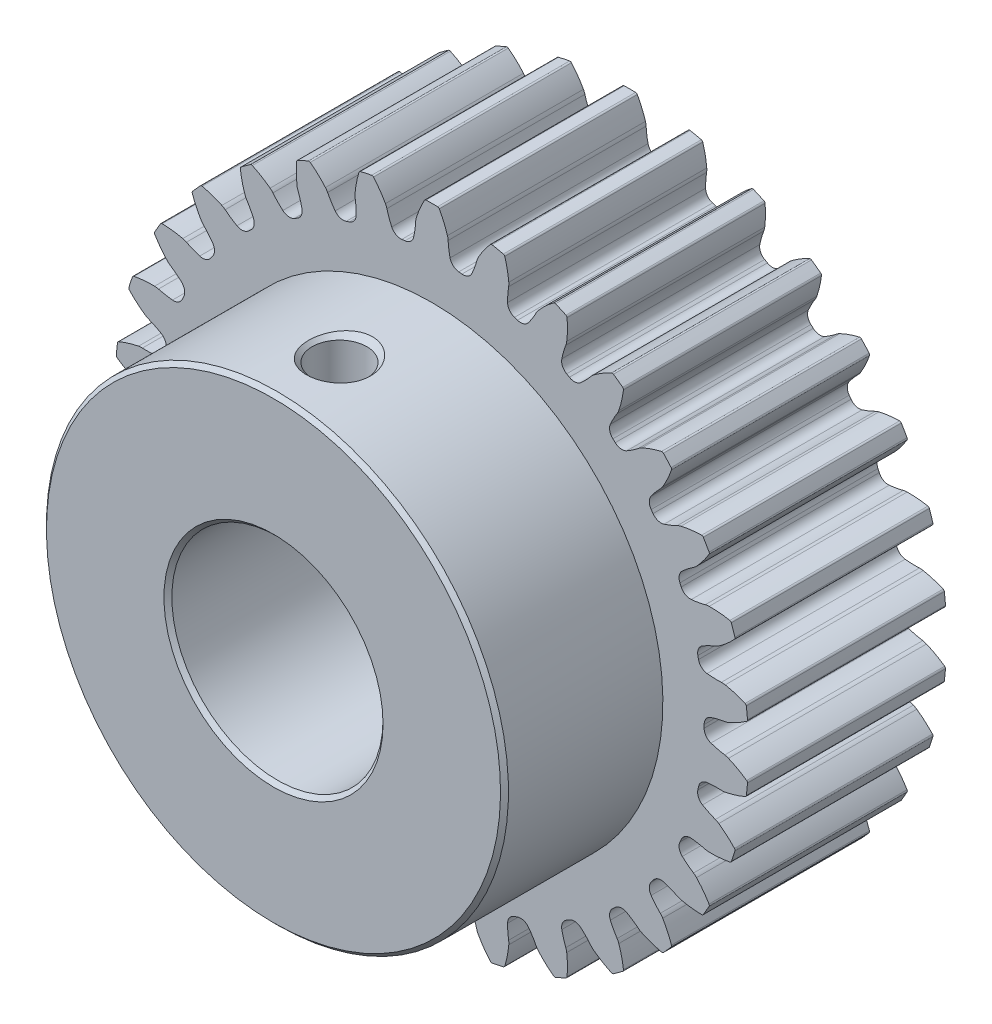
from build123d import *

# Parameters (mm, degrees)
BOSS_EXTRUDE1_DEPTH        = 14.999999999999986
SKETCH2_W                  = 17.5
SKETCH2_H                  = 12.000000000000059
F_16_0_16_DIAMETER_HOLE1_D = 16
FILLET1_R                  = 0.15000000000029293
CHAMFER4_SIZE              = 0.2999999999999612
FILLET2_R                  = 0.750000000002657
FILLET3_R                  = 1.23136375526401
CUT_EXTRUDE1_DEPTH         = 0.1


# Read off the part's stored shape, not the designer's step: CSK for M3.5 Flat Head Machine Screw1
with BuildPart() as part:
    # Sketch1 → Boss-Extrude1 (new body)
    with BuildSketch(Plane.XY.offset(14.999999999999963)):
        with BuildLine():
            ThreePointArc((1.2231787802915635, 22.313983465248278), (0.9222219034490218, 23.175656424877758), (0.5188259000153651, 23.99439142198561))
            ThreePointArc((0.5188259000153651, 23.99439142198561), (-1.696069e-11, 24.000000000541473), (-0.5188259000492833, 23.994391421984897))
            ThreePointArc((-0.5188259000492833, 23.994391421984897), (-0.9222219034977819, 23.175656424861856), (-1.223178780350769, 22.313983465214648))
            ThreePointArc((-1.223178780350769, 22.313983465214648), (-1.3138349595116834, 21.43149171299081), (-1.5208617788278387, 20.56885034391152))
            ThreePointArc((-1.5208617788278387, 20.56885034391152), (-2.155899554963689, 20.51201409246215), (-2.7888771532042846, 20.43557655767753))
            ThreePointArc((-2.7888771532042846, 20.43557655767753), (-3.170733165437452, 21.236323847095935), (-3.4428886419259737, 22.08068255772007))
            ThreePointArc((-3.4428886419259737, 22.08068255772007), (-3.9164207709020538, 22.86095344267094), (-4.481226181387061, 23.577926370584883))
            ThreePointArc((-4.481226181387061, 23.577926370584883), (-4.989880579751382, 23.475542418124537), (-5.496202800014235, 23.362186430347656))
            ThreePointArc((-5.496202800014235, 23.362186430347656), (-5.720559055347514, 22.47747201211657), (-5.835787420387989, 21.572056220878515))
            ThreePointArc((-5.835787420387989, 21.572056220878515), (-5.74098219218881, 20.69000055129112), (-5.764131753173712, 19.80316666979393))
            ThreePointArc((-5.764131753173712, 19.80316666979393), (-6.373475509143122, 19.61554064902886), (-6.976728771086535, 19.40917001506732))
            ThreePointArc((-6.976728771086535, 19.40917001506732), (-7.516725036131348, 20.113026725852343), (-7.958485309662301, 20.882349867522553))
            ThreePointArc((-7.958485309662301, 20.882349867522553), (-8.583897064477329, 21.547117095968833), (-9.285427175338672, 22.130992797323014))
            ThreePointArc((-9.285427175338672, 22.130992797323014), (-9.761679434030855, 21.925090983862418), (-10.233369263894188, 21.70894178747422))
            ThreePointArc((-10.233369263894188, 21.70894178747422), (-10.268880326169867, 20.796914213550714), (-10.193344146917623, 19.8873266054751))
            ThreePointArc((-10.193344146917623, 19.8873266054751), (-9.91722095475834, 19.0442570838499), (-9.755481510518136, 18.171989586049804))
            ThreePointArc((-9.755481510518136, 18.171989586049804), (-10.312500000219863, 17.861773953408015), (-10.859663863579335, 17.534489607252436))
            ThreePointArc((-10.859663863579335, 17.534489607252436), (-11.534199953467802, 18.110693823664615), (-12.12625798028838, 18.77135828347044))
            ThreePointArc((-12.12625798028838, 18.77135828347044), (-12.876215866197487, 19.291568337621637), (-13.683810445275084, 19.716828642519385))
            ThreePointArc((-13.683810445275084, 19.716828642519385), (-14.106846055277872, 19.416407865334193), (-14.523288385757233, 19.106912217416653))
            ThreePointArc((-14.523288385757233, 19.106912217416653), (-14.368402251151066, 18.20743146917753), (-14.105402821100187, 17.333425387425823))
            ThreePointArc((-14.105402821100187, 17.333425387425823), (-13.66002957346505, 16.56618819735303), (-13.320469913827816, 15.74660935850535))
            ThreePointArc((-13.320469913827816, 15.74660935850535), (-13.800818756387203, 15.32736202571702), (-14.267979534747194, 14.893467863783062))
            ThreePointArc((-14.267979534747194, 14.893467863783062), (-15.047574985570186, 15.316836696631597), (-15.764054988899192, 15.839968267463554))
            ThreePointArc((-15.764054988899192, 15.839968267463554), (-16.605782247590824, 16.19288547170547), (-17.484145536508535, 16.44094446419741))
            ThreePointArc((-17.484145536508535, 16.44094446419741), (-17.835475811713412, 16.059134552831537), (-18.178470114653614, 15.66981889832569))
            ThreePointArc((-18.178470114653614, 15.66981889832569), (-17.8399560504744, 14.822196600661677), (-17.400987706731737, 14.021970304957653))
            ThreePointArc((-17.400987706731737, 14.021970304957653), (-16.805829351680593, 13.364097393253639), (-16.30328986315027, 12.63302674139516))
            ThreePointArc((-16.30328986315027, 12.63302674139516), (-16.68597550918335, 12.123070828672295), (-17.052716034848526, 11.601530107888593))
            ThreePointArc((-17.052716034848526, 11.601530107888593), (-17.90329878448461, 11.853560307632172), (-18.712887150120416, 12.216295629579742))
            ThreePointArc((-18.712887150120416, 12.216295629579742), (-19.609596261337074, 12.386495808606238), (-20.52033956951892, 12.44651212040234))
            ThreePointArc((-20.52033956951892, 12.44651212040234), (-20.784609691029953, 12.00000000011154), (-21.039165469523518, 11.547879301264889))
            ThreePointArc((-21.039165469523518, 11.547879301264889), (-20.53181816475962, 10.789160615933142), (-19.93606593036406, 10.097687835315263))
            ThreePointArc((-19.93606593036406, 10.097687835315263), (-19.21713374388583, 9.577931405037365), (-18.573577813564857, 8.967320235701024))
            ThreePointArc((-18.573577813564857, 8.967320235701024), (-18.84187506400098, 8.388943263488152), (-19.092167016175093, 7.80254981600209))
            ThreePointArc((-19.092167016175093, 7.80254981600209), (-19.976562516924844, 7.872226453534833), (-20.8438763484614, 8.05871225243022))
            ThreePointArc((-20.8438763484614, 8.05871225243022), (-21.75637682115064, 8.03875684170439), (-22.65969629579279, 7.908107471987025))
            ThreePointArc((-22.65969629579279, 7.908107471987025), (-22.825356391192418, 7.416407865031748), (-22.98034833622626, 6.92124196590054))
            ThreePointArc((-22.98034833622626, 6.92124196590054), (-22.326341302602113, 6.284586540178793), (-21.599842408916416, 5.732087953208426))
            ThreePointArc((-21.599842408916416, 5.732087953208426), (-20.78855717739548, 5.373163854443546), (-20.03211128756907, 4.909698805790582))
            ThreePointArc((-20.03211128756907, 4.909698805790582), (-20.174294265143267, 4.288178623118547), (-20.297198684493395, 3.662560656397044))
            ThreePointArc((-20.297198684493395, 3.662560656397044), (-21.176754609169894, 3.546838528320049), (-22.063888130330156, 3.548924479900548))
            ThreePointArc((-22.063888130330156, 3.548924479900548), (-22.952299315174958, 3.3396856266285333), (-23.808715560630397, 3.024080579780507))
            ThreePointArc((-23.808715560630397, 3.024080579780507), (-23.86852548882544, 2.508683118423115), (-23.917179708668908, 1.9921131448708729))
            ThreePointArc((-23.917179708668908, 1.9921131448708729), (-23.14509619183324, 1.505345875877211), (-22.319602126644494, 1.1159683219901972))
            ThreePointArc((-22.319602126644494, 1.1159683219901972), (-21.45142090767448, 0.9335632601594162), (-20.61514537355768, 0.6374999787626534))
            ThreePointArc((-20.61514537355768, 0.6374999787626534), (-20.624999999879975, 3.15152e-12), (-20.61514537351956, -0.6374999787557728))
            ThreePointArc((-20.61514537351956, -0.6374999787557728), (-21.451420907635924, -0.9335632601520851), (-22.31960212660537, -1.1159683219828498))
            ThreePointArc((-22.31960212660537, -1.1159683219828498), (-23.145096191761642, -1.5053458758699065), (-23.917179708566838, -1.9921131448568512))
            ThreePointArc((-23.917179708566838, -1.9921131448568512), (-23.86852548869718, -2.5086831184040803), (-23.808715560476102, -3.0240805797559016))
            ThreePointArc((-23.808715560476102, -3.0240805797559016), (-22.952299314990455, -3.3396856265970065), (-22.063888130115814, -3.548924479855548))
            ThreePointArc((-22.063888130115814, -3.548924479855548), (-21.17675460895496, -3.5468385282750825), (-20.297198684277856, -3.6625606563520745))
            ThreePointArc((-20.297198684277856, -3.6625606563520745), (-20.17429426489256, -4.288178623058566), (-20.032111287283925, -4.909698805714563))
            ThreePointArc((-20.032111287283925, -4.909698805714563), (-20.78855717710985, -5.373163854367398), (-21.59984240863037, -5.732087953132043))
            ThreePointArc((-21.59984240863037, -5.732087953132043), (-22.326341302286647, -6.284586540089166), (-22.980348335885797, -6.921241965791525))
            ThreePointArc((-22.980348335885797, -6.921241965791525), (-22.825356390830063, -7.4164078649075265), (-22.659696295409034, -7.908107471847194))
            ThreePointArc((-22.659696295409034, -7.908107471847194), (-21.756376820767308, -8.038756841564494), (-20.8438763480785, -8.05871225229049))
            ThreePointArc((-20.8438763480785, -8.05871225229049), (-19.976562516519447, -7.8722264533696515), (-19.092167015743748, -7.802549815818106))
            ThreePointArc((-19.092167015743748, -7.802549815818106), (-18.841875063542634, -8.38894326327815), (-18.57357781308071, -8.967320235464362))
            ThreePointArc((-18.57357781308071, -8.967320235464362), (-19.21713374340199, -9.577931404798566), (-19.936065929879398, -10.097687835075469))
            ThreePointArc((-19.936065929879398, -10.097687835075469), (-20.531818164253963, -10.789160615669745), (-21.039165469003308, -11.547879300973221))
            ThreePointArc((-21.039165469003308, -11.547879300973221), (-20.784609690495977, -11.999999999796966), (-20.520339568971924, -12.446512120064723))
            ThreePointArc((-20.520339568971924, -12.446512120064723), (-19.609596260790923, -12.386495808268677), (-18.712887149575007, -12.216295629242811))
            ThreePointArc((-18.712887149575007, -12.216295629242811), (-17.903298783927518, -11.853560307263134), (-17.052716034274557, -11.601530107492808))
            ThreePointArc((-17.052716034274557, -11.601530107492808), (-16.68597550859746, -12.123070828239264), (-16.303289862554198, -12.633026740924961))
            ThreePointArc((-16.303289862554198, -12.633026740924961), (-16.805829351082203, -13.364097392784306), (-17.400987706133478, -14.021970304487391))
            ThreePointArc((-17.400987706133478, -14.021970304487391), (-17.839956049866885, -14.822196600161618), (-18.17847011404388, -15.669818897793602))
            ThreePointArc((-18.17847011404388, -15.669818897793602), (-17.83547581110054, -16.059134552272756), (-17.484145535893383, -16.440944463612155))
            ThreePointArc((-17.484145535893383, -16.440944463612155), (-16.60578224697319, -16.19288547111951), (-15.764054988279701, -15.839968266875376))
            ThreePointArc((-15.764054988279701, -15.839968266875376), (-15.047574984954789, -15.316836696012146), (-14.26797953413033, -14.893467863134582))
            ThreePointArc((-14.26797953413033, -14.893467863134582), (-13.800818755772095, -15.327362025031428), (-13.320469913216149, -15.746609357783337))
            ThreePointArc((-13.320469913216149, -15.746609357783337), (-13.660029572858292, -16.566188196629483), (-14.105402820492882, -17.333425386703126))
            ThreePointArc((-14.105402820492882, -17.333425386703126), (-14.368402250546414, -18.207431468422413), (-14.523288385162795, -19.106912216629055))
            ThreePointArc((-14.523288385162795, -19.106912216629055), (-14.106846054691305, -19.416407864520913), (-13.683810444697228, -19.71682864168098))
            ThreePointArc((-13.683810444697228, -19.71682864168098), (-12.876215865620614, -19.291568336783776), (-12.126257979712067, -18.771358282633738))
            ThreePointArc((-12.126257979712067, -18.771358282633738), (-11.534199952906238, -18.110693822797714), (-10.859663863027334, -17.53448960635487))
            ThreePointArc((-10.859663863027334, -17.53448960635487), (-10.312499999685754, -17.86177395247695), (-9.755481510003428, -18.17198958508668))
            ThreePointArc((-9.755481510003428, -18.17198958508668), (-9.917220954244584, -19.04425708288714), (-10.193344146404042, -19.887326604512833))
            ThreePointArc((-10.193344146404042, -19.887326604512833), (-10.268880325671923, -20.796914212560846), (-10.233369263418545, -21.708941786458997))
            ThreePointArc((-10.233369263418545, -21.708941786458997), (-9.761679433572567, -21.92509098282703), (-9.285427174898382, -22.130992796268306))
            ThreePointArc((-9.285427174898382, -22.130992796268306), (-8.583897064036986, -21.54711709491399), (-7.95848530922207, -20.882349866467425))
            ThreePointArc((-7.95848530922207, -20.882349866467425), (-7.516725035712751, -20.113026724778077), (-6.9767287706859955, -19.409170013971863))
            ThreePointArc((-6.9767287706859955, -19.409170013971863), (-6.3734755087807065, -19.615540647907174), (-5.764131752850617, -19.80316666864853))
            ThreePointArc((-5.764131752850617, -19.80316666864853), (-5.740982191863119, -20.690000550156576), (-5.835787420062725, -21.572056219754906))
            ThreePointArc((-5.835787420062725, -21.572056219754906), (-5.72055905504415, -22.47747201096548), (-5.496202799739497, -23.36218642917285))
            ThreePointArc((-5.496202799739497, -23.36218642917285), (-4.989880579500916, -23.47554241693834), (-4.48122618116122, -23.57792636938837))
            ThreePointArc((-4.48122618116122, -23.57792636938837), (-3.9164207706752387, -22.86095344147321), (-3.4428886416989966, -22.08068255652062))
            ThreePointArc((-3.4428886416989966, -22.08068255652062), (-3.1707331652418738, -21.23632384588983), (-2.7888771530389396, -20.43557655646066))
            ThreePointArc((-2.7888771530389396, -20.43557655646066), (-2.1558995548354685, -20.51201409123619), (-1.5208617787371066, -20.568850342678786))
            ThreePointArc((-1.5208617787371066, -20.568850342678786), (-1.31383495942075, -21.431491711757992), (-1.2231787802599614, -22.313983463981806))
            ThreePointArc((-1.2231787802599614, -22.313983463981806), (-0.9222219034379213, -23.17565642362364), (-0.5188259000226928, -23.994391420746034))
            ThreePointArc((-0.5188259000226928, -23.994391420746034), (-1.691806e-11, -23.99999999930204), (0.5188258999888663, -23.994391420746748))
            ThreePointArc((0.5188258999888663, -23.994391420746748), (0.9222219034225132, -23.175656423638827), (1.2231787802649363, -22.313983464009244))
            ThreePointArc((1.2231787802649363, -22.313983464009244), (1.3138349594054564, -21.43149171177405), (1.5208617787043899, -20.568850342681152))
            ThreePointArc((1.5208617787043899, -20.568850342681152), (2.1558995548032636, -20.512014091239493), (2.7888771530072796, -20.435576556464873))
            ThreePointArc((2.7888771530072796, -20.435576556464873), (3.17073316522213, -21.236323845874566), (3.4428886416975404, -22.080682556486376))
            ThreePointArc((3.4428886416975404, -22.080682556486376), (3.916420770656626, -22.860953441458165), (4.481226181127741, -23.577926369394593))
            ThreePointArc((4.481226181127741, -23.577926369394593), (4.989880579468132, -23.47554241694515), (5.496202799707409, -23.362186429180223))
            ThreePointArc((5.496202799707409, -23.362186429180223), (5.720559055031852, -22.477472010979184), (5.83578742007099, -21.572056219772506))
            ThreePointArc((5.83578742007099, -21.572056219772506), (5.740982191851119, -20.69000055017114), (5.764131752819407, -19.8031666686574))
            ThreePointArc((5.764131752819407, -19.8031666686574), (6.373475508750502, -19.615540647916742), (6.97672877065681, -19.409170013982088))
            ThreePointArc((6.97672877065681, -19.409170013982088), (7.516725035689554, -20.113026724763348), (7.958485309210426, -20.882349866427425))
            ThreePointArc((7.958485309210426, -20.882349866427425), (8.583897064015003, -21.547117094899708), (9.285427174870023, -22.130992796279898))
            ThreePointArc((9.285427174870023, -22.130992796279898), (9.761679433544888, -21.925090982839023), (10.233369263391554, -21.708941786471378))
            ThreePointArc((10.233369263391554, -21.708941786471378), (10.268880325667325, -20.79691421258311), (10.193344146423735, -19.887326604542107))
            ThreePointArc((10.193344146423735, -19.887326604542107), (9.917220954239848, -19.044257082910253), (9.755481509977972, -18.17198958509995))
            ThreePointArc((9.755481509977972, -18.17198958509995), (10.312499999660215, -17.861773952491262), (10.859663863001753, -17.534489606370254))
            ThreePointArc((10.859663863001753, -17.534489606370254), (11.534199952873347, -18.11069382277715), (12.12625797967875, -18.771358282574738))
            ThreePointArc((12.12625797967875, -18.771358282574738), (12.876215865589892, -19.291568336763078), (13.683810444674744, -19.71682864169608))
            ThreePointArc((13.683810444674744, -19.71682864169608), (14.106846054669441, -19.416407864536264), (14.52328838514155, -19.10691221664465))
            ThreePointArc((14.52328838514155, -19.10691221664465), (14.368402250546549, -18.20743146844254), (14.105402820516288, -17.333425386724702))
            ThreePointArc((14.105402820516288, -17.333425386724702), (13.6600295728581, -16.566188196650394), (13.320469913197563, -15.746609357798432))
            ThreePointArc((13.320469913197563, -15.746609357798432), (13.800818755754266, -15.327362025046819), (14.267979534113248, -14.893467863150237))
            ThreePointArc((14.267979534113248, -14.893467863150237), (15.04757498491907, -15.3168366959964), (15.764054988232644, -15.83996826682198))
            ThreePointArc((15.764054988232644, -15.83996826682198), (16.605782246938976, -16.192885471103274), (17.48414553587716, -16.44094446362863))
            ThreePointArc((17.48414553587716, -16.44094446362863), (17.83547581108495, -16.059134552289258), (18.17847011402893, -15.669818897810092))
            ThreePointArc((18.17847011402893, -15.669818897810092), (17.839956049872043, -14.822196600178657), (17.400987706158876, -14.021970304502414))
            ThreePointArc((17.400987706158876, -14.021970304502414), (16.80582935108867, -13.364097392801554), (16.303289862538893, -12.633026740943766))
            ThreePointArc((16.303289862538893, -12.633026740943766), (16.685975508585194, -12.123070828255127), (17.052716034265146, -11.60153010750557))
            ThreePointArc((17.052716034265146, -11.60153010750557), (17.90329878389009, -11.853560307253307), (18.712887149516607, -12.216295629198383))
            ThreePointArc((18.712887149516607, -12.216295629198383), (19.60959626075501, -12.386495808256422), (20.5203395689624, -12.4465121200792))
            ThreePointArc((20.5203395689624, -12.4465121200792), (20.784609690487205, -11.999999999810873), (21.03916546899526, -11.547879300986537))
            ThreePointArc((21.03916546899526, -11.547879300986537), (20.531818164249877, -10.789160615673858), (19.93606592987788, -10.097687835070179))
            ThreePointArc((19.93606592987788, -10.097687835070179), (19.21713374339856, -9.577931404802056), (18.573577813074216, -8.967320235476299))
            ThreePointArc((18.573577813074216, -8.967320235476299), (18.8418750635366, -8.38894326329007), (19.09216701573816, -7.802549815829989))
            ThreePointArc((19.09216701573816, -7.802549815829989), (19.976562516490258, -7.872226453367115), (20.84387634802858, -8.058712252267073))
            ThreePointArc((20.84387634802858, -8.058712252267073), (21.75637682073939, -8.038756841560334), (22.659696295404924, -7.908107471856872))
            ThreePointArc((22.659696295404924, -7.908107471856872), (22.82535639082618, -7.416407864917207), (22.980348335882145, -6.921241965801194))
            ThreePointArc((22.980348335882145, -6.921241965801194), (22.32634130228788, -6.284586540092574), (21.59984240863564, -5.73208795312871))
            ThreePointArc((21.59984240863564, -5.73208795312871), (20.788557177111453, -5.373163854369299), (20.03211128728182, -4.909698805720144))
            ThreePointArc((20.03211128728182, -4.909698805720144), (20.17429426489052, -4.288178623064702), (20.297198684275916, -3.6625606563587687))
            ThreePointArc((20.297198684275916, -3.6625606563587687), (21.176754608983988, -3.546838528286451), (22.06388813017491, -3.548924479879939))
            ThreePointArc((22.06388813017491, -3.548924479879939), (22.95229931501955, -3.339685626607999), (23.808715560474838, -3.0240805797600823))
            ThreePointArc((23.808715560474838, -3.0240805797600823), (23.868525488696093, -2.508683118407406), (23.917179708565893, -1.9921131448593143))
            ThreePointArc((23.917179708565893, -1.9921131448593143), (23.14509619176534, -1.5053458758694012), (22.319602126613503, -1.1159683219784584))
            ThreePointArc((22.319602126613503, -1.1159683219784584), (21.451420907639697, -0.933563260150855), (20.6151453735188, -0.6374999787565113))
            ThreePointArc((20.6151453735188, -0.6374999787565113), (20.62499999987923, 3.6675e-12), (20.615145373556885, 0.6374999787644352))
            ThreePointArc((20.615145373556885, 0.6374999787644352), (21.451420907708304, 0.9335632601657586), (22.31960212671403, 1.115968321992694))
            ThreePointArc((22.31960212671403, 1.115968321992694), (23.145096191866717, 1.5053458758836173), (23.91717970866792, 1.9921131448739104))
            ThreePointArc((23.91717970866792, 1.9921131448739104), (23.868525488824282, 2.5086831184272023), (23.808715560629025, 3.024080579785638))
            ThreePointArc((23.808715560629025, 3.024080579785638), (22.952299315174148, 3.339685626633328), (22.063888130330053, 3.548924479905543))
            ThreePointArc((22.063888130330053, 3.548924479905543), (21.1767546091689, 3.5468385283252077), (20.297198684491597, 3.6625606564029205))
            ThreePointArc((20.297198684491597, 3.6625606564029205), (20.174294265141093, 4.288178623125283), (20.032111287566476, 4.909698805798158))
            ThreePointArc((20.032111287566476, 4.909698805798158), (20.78855717742217, 5.3731638544658145), (21.599842408975952, 5.732087953237158))
            ThreePointArc((21.599842408975952, 5.732087953237158), (22.32634130262843, 6.2845865402008325), (22.98034833622286, 6.921241965909382))
            ThreePointArc((22.98034833622286, 6.921241965909382), (22.825356391188585, 7.416407865041283), (22.659696295788493, 7.908107471997242))
            ThreePointArc((22.659696295788493, 7.908107471997242), (21.756376821146574, 8.03875684171852), (20.84387634845709, 8.058712252448343))
            ThreePointArc((20.84387634845709, 8.058712252448343), (19.976562516920687, 7.872226453548568), (19.092167016170496, 7.802549816011527))
            ThreePointArc((19.092167016170496, 7.802549816011527), (18.84187506399458, 8.388943263500861), (18.573577813556447, 8.967320235716908))
            ThreePointArc((18.573577813556447, 8.967320235716908), (19.21713374389535, 9.577931405069815), (19.93606593039542, 10.097687835359165))
            ThreePointArc((19.93606593039542, 10.097687835359165), (20.531818164769085, 10.78916061596383), (21.03916546951561, 11.547879301277954))
            ThreePointArc((21.03916546951561, 11.547879301277954), (20.784609691021128, 12.000000000125535), (20.520339569509144, 12.44651212041724))
            ThreePointArc((20.520339569509144, 12.44651212041724), (19.609596261320835, 12.386495808624936), (18.71288715009737, 12.216295629601083))
            ThreePointArc((18.71288715009737, 12.216295629601083), (17.903298784465495, 11.853560307653556), (17.052716034833118, 11.601530107910161))
            ThreePointArc((17.052716034833118, 11.601530107910161), (16.68597550917143, 12.123070828687688), (16.303289863142208, 12.633026741404608))
            ThreePointArc((16.303289863142208, 12.633026741404608), (16.805829351689724, 13.364097393300764), (17.400987706769357, 14.021970305034008))
            ThreePointArc((17.400987706769357, 14.021970305034008), (17.839956050482403, 14.822196600710122), (18.178470114639392, 15.669818898341333))
            ThreePointArc((18.178470114639392, 15.669818898341333), (17.835475811698423, 16.059134552847357), (17.484145536492772, 16.440944464213388))
            ThreePointArc((17.484145536492772, 16.440944464213388), (16.605782247556682, 16.192885471719357), (15.764054988848155, 15.839968267470535))
            ThreePointArc((15.764054988848155, 15.839968267470535), (15.047574985535123, 15.316836696645371), (14.267979534730578, 14.89346786379828))
            ThreePointArc((14.267979534730578, 14.89346786379828), (13.800818756368148, 15.327362025733523), (13.320469913806214, 15.746609358523004))
            ThreePointArc((13.320469913806214, 15.746609358523004), (13.660029573454718, 16.566188197405054), (14.105402821108097, 17.333425387508964))
            ThreePointArc((14.105402821108097, 17.333425387508964), (14.368402251139912, 18.207431469228574), (14.52328838573525, 19.106912217432804))
            ThreePointArc((14.52328838573525, 19.106912217432804), (14.106846055255398, 19.416407865349978), (13.683810445252137, 19.7168286425348))
            ThreePointArc((13.683810445252137, 19.7168286425348), (12.876215866155622, 19.291568337631155), (12.126257980229468, 18.77135828347034))
            ThreePointArc((12.126257980229468, 18.77135828347034), (11.534199953424842, 18.110693823673877), (10.859663863554946, 17.534489607267083))
            ThreePointArc((10.859663863554946, 17.534489607267083), (10.312500000194369, 17.86177395342231), (9.755481510491533, 18.17198958606369))
            ThreePointArc((9.755481510491533, 18.17198958606369), (9.917220954731228, 19.04425708389686), (10.193344146897873, 19.88732660555376))
            ThreePointArc((10.193344146897873, 19.88732660555376), (10.268880326142684, 20.79691421359659), (10.233369263866821, 21.70894178748678))
            ThreePointArc((10.233369263866821, 21.70894178748678), (9.761679434002478, 21.925090983874735), (9.285427175309282, 22.130992797335036))
            ThreePointArc((9.285427175309282, 22.130992797335036), (8.583897064432719, 21.547117095978265), (7.958485309603566, 20.882349867526933))
            ThreePointArc((7.958485309603566, 20.882349867526933), (7.516725036082496, 20.11302672586206), (6.976728771048604, 19.409170015080694))
            ThreePointArc((6.976728771048604, 19.409170015080694), (6.373475509112457, 19.61554064903858), (5.764131753150484, 19.803166669800472))
            ThreePointArc((5.764131753150484, 19.803166669800472), (5.740982192152049, 20.690000551328183), (5.835787420345929, 21.57205622094719))
            ThreePointArc((5.835787420345929, 21.57205622094719), (5.720559055306663, 22.477472012153928), (5.49620279998216, 23.36218643035503))
            ThreePointArc((5.49620279998216, 23.36218643035503), (4.9898805797192765, 23.475542418131212), (4.481226181354936, 23.577926370590852))
            ThreePointArc((4.481226181354936, 23.577926370590852), (3.9164207708520165, 22.860953442665647), (3.4428886418618747, 22.080682557699998))
            ThreePointArc((3.4428886418618747, 22.080682557699998), (3.1707331653871815, 21.236323847089544), (2.788877153171553, 20.435576557681898))
            ThreePointArc((2.788877153171553, 20.435576557681898), (2.1558995549306292, 20.512014092465552), (1.5208617787944851, 20.568850343913933))
            ThreePointArc((1.5208617787944851, 20.568850343913933), (1.3138349594631196, 21.431491713007755), (1.2231787802915635, 22.313983465248278))
        make_face()
    extrude(amount=-BOSS_EXTRUDE1_DEPTH)

    # Sketch2 → Revolve1 (revolve)
    with BuildSketch(Plane.XZ, mode=Mode.PRIVATE) as revolve1_sk:
        with Locations((8.75, 20.999999999999993)):
            Rectangle(SKETCH2_W, SKETCH2_H)
    revolve(revolve1_sk.sketch.rotate(Axis((0, -5.684e-14, 27.000000000000025), (0, 2.11e-15, -1)), 270), axis=Axis((0, -5.684e-14, 27.000000000000025), (0, 2.11e-15, -1)))

    # Ø16.0 (16) Diameter Hole1 (through all)
    with Locations(Plane.XY.offset(27.000000000000025)):
        with Locations((0, 0)):
            Hole(F_16_0_16_DIAMETER_HOLE1_D / 2)

    # CSK for M3.5 Flat Head Machine Screw1 ou → CSK for M3.5 Flat Head Machine Screw1 (revolve, cut)
    with BuildSketch(Plane.XY.offset(22)):
        Polygon((0, 7.728317894), (2.067, 7.728317894), (2.067, 17.067), (2.49998048, 17.49998048), (0, 17.49998048), align=None)
    revolve(axis=Axis((0, 0, 22), (0, 1, 0)), mode=Mode.SUBTRACT)

    # Fillet1
    fillet1_edges = [part.edges().sort_by_distance(p)[0] for p in [
        (4.481226181354936, 23.577926370590852, 7.49999999999997),
        (5.496202799982161, 23.362186430355035, 7.49999999999997),
        (9.285427175309284, 22.130992797335036, 7.49999999999997),
        (10.23336926386682, 21.70894178748678, 7.49999999999997),
        (13.683810445252137, 19.7168286425348, 7.49999999999997),
        (14.523288385735253, 19.106912217432804, 7.49999999999997),
        (17.48414553649277, 16.440944464213388, 7.49999999999997),
        (18.17847011463939, 15.669818898341333, 7.49999999999997),
        (20.520339569509144, 12.446512120417239, 7.49999999999997),
        (21.03916546951561, 11.547879301277952, 7.49999999999997),
        (22.659696295788493, 7.9081074719972415, 7.49999999999997),
        (22.98034833622286, 6.921241965909383, 7.49999999999997),
        (23.80871556062903, 3.024080579785638, 7.49999999999997),
        (23.917179708667923, 1.9921131448739104, 7.49999999999997),
        (23.917179708565897, -1.9921131448593146, 7.49999999999997),
        (23.808715560474838, -3.0240805797600827, 7.49999999999997),
        (22.980348335882148, -6.921241965801194, 7.49999999999997),
        (22.659696295404927, -7.908107471856873, 7.49999999999997),
        (21.039165468995257, -11.547879300986535, 7.49999999999997),
        (20.5203395689624, -12.4465121200792, 7.49999999999997),
        (18.178470114028926, -15.66981889781009, 7.49999999999997),
        (17.48414553587716, -16.44094446362863, 7.49999999999997),
        (14.52328838514155, -19.106912216644645, 7.49999999999997),
        (13.683810444674744, -19.716828641696075, 7.49999999999997),
        (10.233369263391555, -21.708941786471378, 7.49999999999997),
        (9.285427174870023, -22.130992796279898, 7.49999999999997),
        (5.49620279970741, -23.362186429180227, 7.49999999999997),
        (4.481226181127741, -23.577926369394596, 7.49999999999997),
        (0.5188258999888664, -23.994391420746744, 7.49999999999997),
        (-0.5188259000226935, -23.994391420746034, 7.49999999999997),
        (-4.481226181161219, -23.577926369388372, 7.49999999999997),
        (-5.496202799739498, -23.36218642917285, 7.49999999999997),
        (-9.28542717489838, -22.13099279626831, 7.49999999999997),
        (-10.233369263418545, -21.708941786459, 7.49999999999997),
        (-13.68381044469723, -19.716828641680983, 7.49999999999997),
        (-14.523288385162797, -19.10691221662906, 7.49999999999997),
        (-17.484145535893383, -16.440944463612155, 7.49999999999997),
        (-18.178470114043876, -15.669818897793602, 7.49999999999997),
        (-20.520339568971927, -12.446512120064725, 7.49999999999997),
        (-21.039165469003308, -11.547879300973223, 7.49999999999997),
        (-22.659696295409034, -7.908107471847195, 7.49999999999997),
        (-22.980348335885797, -6.921241965791525, 7.49999999999997),
        (-23.808715560476102, -3.0240805797559016, 7.49999999999997),
        (-23.917179708566835, -1.9921131448568514, 7.49999999999997),
        (-23.91717970866891, 1.9921131448708733, 7.49999999999997),
        (-23.8087155606304, 3.0240805797805073, 7.49999999999997),
        (-22.98034833622626, 6.92124196590054, 7.49999999999997),
        (-22.65969629579279, 7.908107471987025, 7.49999999999997),
        (-21.039165469523518, 11.547879301264889, 7.49999999999997),
        (-20.520339569518924, 12.446512120402343, 7.49999999999997),
        (-18.178470114653614, 15.66981889832569, 7.49999999999997),
        (-17.484145536508535, 16.44094446419741, 7.49999999999997),
        (-14.523288385757233, 19.106912217416653, 7.49999999999997),
        (-13.683810445275085, 19.716828642519385, 7.49999999999997),
        (-10.233369263894188, 21.70894178747422, 7.49999999999997),
        (-9.285427175338672, 22.13099279732301, 7.49999999999997),
        (-5.496202800014235, 23.362186430347656, 7.49999999999997),
        (-4.481226181387061, 23.577926370584883, 7.49999999999997),
        (-0.5188259000492834, 23.994391421984897, 7.49999999999997),
        (0.518825900015365, 23.99439142198561, 7.49999999999997),
    ]]
    fillet(fillet1_edges, radius=FILLET1_R)

    # Chamfer4
    chamfer4_edges = [part.edges().sort_by_distance(p)[0] for p in [
        (6.03e-15, -17.500000000000057, 26.99999999999999),
        (8, -5.586e-14, 27.00000000000003),
        (8, -5.586e-14, -2.842e-14),
    ]]
    chamfer(chamfer4_edges, length=CHAMFER4_SIZE)

    # Fillet2
    fillet2_edges = [part.edges().sort_by_distance(p)[0] for p in [
        (1.5208617787944847, 20.568850343913937, 7.49999999999997),
        (2.788877153171553, 20.435576557681898, 7.49999999999997),
        (5.764131753150485, 19.803166669800476, 7.49999999999997),
        (6.976728771048604, 19.409170015080697, 7.49999999999997),
        (9.755481510491535, 18.171989586063695, 7.49999999999997),
        (10.859663863554946, 17.534489607267083, 7.49999999999997),
        (13.320469913806214, 15.746609358523006, 7.49999999999997),
        (14.267979534730578, 14.89346786379828, 7.49999999999997),
        (16.303289863142204, 12.63302674140461, 7.49999999999997),
        (17.052716034833118, 11.601530107910161, 7.49999999999997),
        (18.573577813556447, 8.967320235716908, 7.49999999999997),
        (19.0921670161705, 7.802549816011527, 7.49999999999997),
        (20.03211128756648, 4.9096988057981585, 7.49999999999997),
        (20.297198684491597, 3.6625606564029205, 7.49999999999997),
        (20.615145373556885, 0.6374999787644355, 7.49999999999997),
        (20.6151453735188, -0.6374999787565122, 7.49999999999997),
        (20.297198684275912, -3.6625606563587683, 7.49999999999997),
        (20.032111287281815, -4.909698805720143, 7.49999999999997),
        (19.092167015738163, -7.802549815829989, 7.49999999999997),
        (18.573577813074216, -8.9673202354763, 7.49999999999997),
        (17.052716034265146, -11.601530107505571, 7.49999999999997),
        (16.303289862538893, -12.633026740943766, 7.49999999999997),
        (14.267979534113248, -14.893467863150235, 7.49999999999997),
        (13.320469913197563, -15.746609357798432, 7.49999999999997),
        (10.859663863001753, -17.534489606370258, 7.49999999999997),
        (9.755481509977972, -18.17198958509995, 7.49999999999997),
        (6.976728770656811, -19.40917001398209, 7.49999999999997),
        (5.764131752819407, -19.8031666686574, 7.49999999999997),
        (2.7888771530072796, -20.435576556464873, 7.49999999999997),
        (1.5208617787043888, -20.568850342681152, 7.49999999999997),
        (-1.5208617787371068, -20.568850342678786, 7.49999999999997),
        (-2.7888771530389396, -20.43557655646066, 7.49999999999997),
        (-5.764131752850619, -19.80316666864853, 7.49999999999997),
        (-6.976728770685996, -19.409170013971863, 7.49999999999997),
        (-9.755481510003428, -18.17198958508668, 7.49999999999997),
        (-10.859663863027336, -17.53448960635487, 7.49999999999997),
        (-13.32046991321615, -15.746609357783338, 7.49999999999997),
        (-14.26797953413033, -14.893467863134582, 7.49999999999997),
        (-16.303289862554195, -12.633026740924961, 7.49999999999997),
        (-17.052716034274553, -11.601530107492808, 7.49999999999997),
        (-18.57357781308071, -8.96732023546436, 7.49999999999997),
        (-19.092167015743748, -7.8025498158181055, 7.49999999999997),
        (-20.032111287283925, -4.909698805714563, 7.49999999999997),
        (-20.297198684277856, -3.662560656352074, 7.49999999999997),
        (-20.61514537351956, -0.637499978755773, 7.49999999999997),
        (-20.61514537355768, 0.6374999787626533, 7.49999999999997),
        (-20.297198684493395, 3.6625606563970434, 7.49999999999997),
        (-20.03211128756907, 4.909698805790583, 7.49999999999997),
        (-19.092167016175097, 7.80254981600209, 7.49999999999997),
        (-18.57357781356486, 8.967320235701024, 7.49999999999997),
        (-17.05271603484853, 11.601530107888593, 7.49999999999997),
        (-16.30328986315027, 12.63302674139516, 7.49999999999997),
        (-14.267979534747194, 14.893467863783062, 7.49999999999997),
        (-13.320469913827818, 15.74660935850535, 7.49999999999997),
        (-10.859663863579334, 17.534489607252432, 7.49999999999997),
        (-9.755481510518134, 18.171989586049804, 7.49999999999997),
        (-6.976728771086535, 19.409170015067325, 7.49999999999997),
        (-5.764131753173713, 19.80316666979393, 7.49999999999997),
        (-2.788877153204285, 20.43557655767753, 7.49999999999997),
        (-1.5208617788278385, 20.56885034391152, 7.49999999999997),
    ]]
    fillet(fillet2_edges, radius=FILLET2_R)

    # Fillet3
    fillet3_edges = [part.edges().sort_by_distance(p)[0] for p in [
        (3.4428886418618743, 22.080682557699998, 7.49999999999997),
        (5.835787420345929, 21.57205622094719, 7.49999999999997),
        (7.958485309603567, 20.882349867526933, 7.49999999999997),
        (10.193344146897875, 19.88732660555376, 7.49999999999997),
        (12.126257980229468, 18.77135828347034, 7.49999999999997),
        (14.105402821108097, 17.333425387508964, 7.49999999999997),
        (15.764054988848155, 15.839968267470535, 7.49999999999997),
        (17.400987706769357, 14.02197030503401, 7.49999999999997),
        (18.71288715009737, 12.216295629601081, 7.49999999999997),
        (19.93606593039542, 10.097687835359167, 7.49999999999997),
        (20.84387634845709, 8.058712252448341, 7.49999999999997),
        (21.599842408975952, 5.7320879532371585, 7.49999999999997),
        (22.063888130330053, 3.5489244799055415, 7.49999999999997),
        (22.31960212671403, 1.1159683219926935, 7.49999999999997),
        (22.319602126613503, -1.11596832197846, 7.49999999999997),
        (22.06388813017491, -3.548924479879939, 7.49999999999997),
        (21.59984240863564, -5.732087953128709, 7.49999999999997),
        (20.84387634802858, -8.058712252267071, 7.49999999999997),
        (19.93606592987788, -10.097687835070179, 7.49999999999997),
        (18.712887149516607, -12.216295629198383, 7.49999999999997),
        (17.40098770615888, -14.021970304502414, 7.49999999999997),
        (15.764054988232644, -15.83996826682198, 7.49999999999997),
        (14.105402820516286, -17.333425386724702, 7.49999999999997),
        (12.12625797967875, -18.771358282574738, 7.49999999999997),
        (10.193344146423733, -19.887326604542107, 7.49999999999997),
        (7.958485309210427, -20.882349866427425, 7.49999999999997),
        (5.83578742007099, -21.572056219772506, 7.49999999999997),
        (3.4428886416975404, -22.080682556486376, 7.49999999999997),
        (1.2231787802649352, -22.313983464009244, 7.49999999999997),
        (-1.2231787802599623, -22.313983463981806, 7.49999999999997),
        (-3.442888641698997, -22.08068255652062, 7.49999999999997),
        (-5.835787420062727, -21.572056219754906, 7.49999999999997),
        (-7.95848530922207, -20.882349866467425, 7.49999999999997),
        (-10.193344146404044, -19.887326604512833, 7.49999999999997),
        (-12.126257979712067, -18.771358282633738, 7.49999999999997),
        (-14.105402820492882, -17.333425386703126, 7.49999999999997),
        (-15.764054988279701, -15.839968266875374, 7.49999999999997),
        (-17.400987706133478, -14.02197030448739, 7.49999999999997),
        (-18.712887149575007, -12.216295629242811, 7.49999999999997),
        (-19.936065929879398, -10.097687835075469, 7.49999999999997),
        (-20.8438763480785, -8.05871225229049, 7.49999999999997),
        (-21.59984240863037, -5.732087953132043, 7.49999999999997),
        (-22.063888130115814, -3.5489244798555477, 7.49999999999997),
        (-22.31960212660537, -1.1159683219828498, 7.49999999999997),
        (-22.319602126644494, 1.1159683219901981, 7.49999999999997),
        (-22.063888130330156, 3.5489244799005477, 7.49999999999997),
        (-21.599842408916416, 5.732087953208426, 7.49999999999997),
        (-20.8438763484614, 8.05871225243022, 7.49999999999997),
        (-19.93606593036406, 10.097687835315263, 7.49999999999997),
        (-18.712887150120416, 12.21629562957974, 7.49999999999997),
        (-17.400987706731733, 14.021970304957655, 7.49999999999997),
        (-15.764054988899192, 15.839968267463554, 7.49999999999997),
        (-14.105402821100187, 17.333425387425823, 7.49999999999997),
        (-12.12625798028838, 18.77135828347044, 7.49999999999997),
        (-10.193344146917624, 19.8873266054751, 7.49999999999997),
        (-7.958485309662301, 20.882349867522553, 7.49999999999997),
        (-5.835787420387989, 21.572056220878515, 7.49999999999997),
        (-3.4428886419259728, 22.08068255772007, 7.49999999999997),
        (-1.2231787803507692, 22.313983465214648, 7.49999999999997),
        (1.2231787802915637, 22.313983465248278, 7.49999999999997),
    ]]
    fillet(fillet3_edges, radius=FILLET3_R)

    # Sketch7 → Cut-Extrude1 (cut)
    with BuildSketch(Plane.XZ.offset(-17.49998048042601)):
        Polygon((-0.02613780225503783, 24.499980480426068), (-0.0261378022550328, 19.500156161316276), (0.02613780225503783, 19.500156161316344), (0.02613780225503783, 24.499980480426068), align=None)
    extrude(amount=-CUT_EXTRUDE1_DEPTH, mode=Mode.SUBTRACT)


solid = part.part
